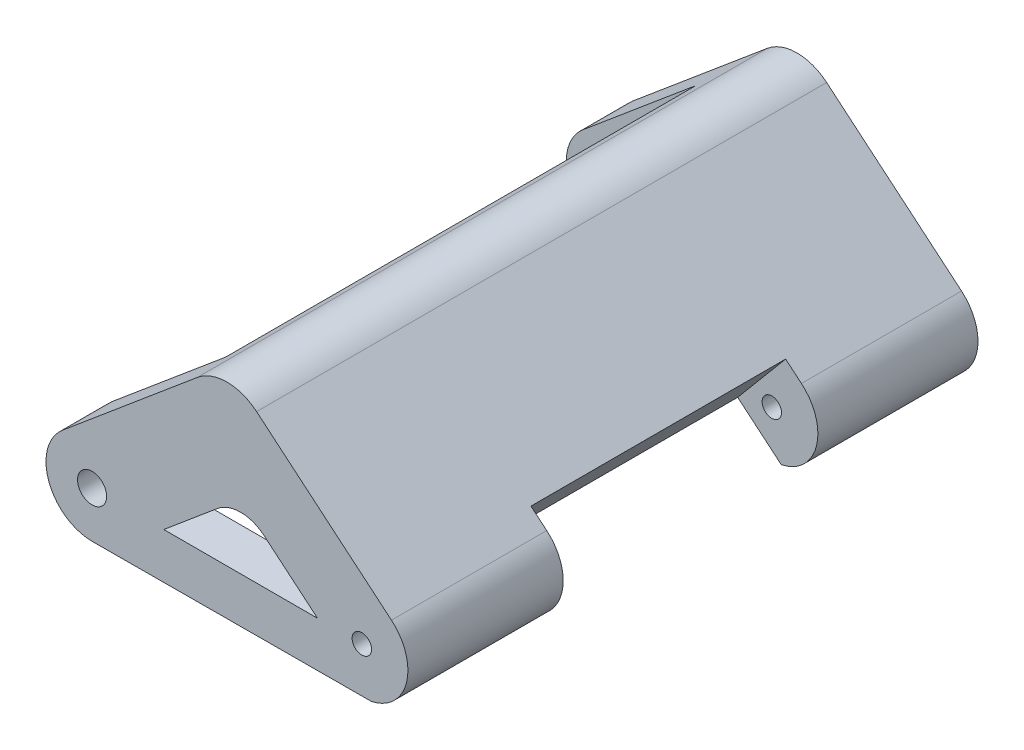
from build123d import *

# Parameters (mm, degrees)
SKETCH_1_R          = 1.2
SKETCH_1_R_2        = 0.8
EXTRUDE_3_DEPTH     = 47
SKETCH_6_W          = 5.5
SKETCH_6_H          = 21
CUT_EXTRUDE_4_DEPTH = 53.526968295
SKETCH_7_W          = 15
SKETCH_7_H          = 38.8
CUT_EXTRUDE_5_DEPTH = 56.899041136
CUT_EXTRUDE_6_DEPTH = 56.31273986
CUT_EXTRUDE_7_DEPTH = 56.31273986
SKETCH_10_W         = 38.8
SKETCH_10_H         = 7.6
CUT_EXTRUDE_8_DEPTH = 1
EXTRUDE_4_DEPTH     = 3.5
FILLET_1_R          = 3
SKETCH_12_R         = 3.5
CUT_EXTRUDE_9_DEPTH = 2


with BuildPart() as part:
    # 草图1 → 凸台-拉伸3 (new body)
    with BuildSketch(Plane.XY):
        with BuildLine():
            Line((8.677407083, 12.241756783), (-2.442592917, 2.910968884))
            ThreePointArc((-2.442592917, 2.910968884), (-2.910968884, -2.442592917), (2.442592917, -2.910968884))
            Line((2.442592917, -2.910968884), (11.12, 4.370240199))
            Line((11.12, 4.370240199), (19.797407083, -2.910968884))
            ThreePointArc((19.797407083, -2.910968884), (25.150968884, -2.442592917), (24.682592917, 2.910968884))
            Line((24.682592917, 2.910968884), (13.562592917, 12.241756783))
            ThreePointArc((13.562592917, 12.241756783), (11.12, 13.130787899), (8.677407083, 12.241756783))
        make_face()
        Circle(SKETCH_1_R, mode=Mode.SUBTRACT)
        with Locations((22.24, 0)):
            Circle(SKETCH_1_R_2, mode=Mode.SUBTRACT)
    extrude(amount=EXTRUDE_3_DEPTH)

    # 草图6 → 切除-拉伸4 (cut, through all)
    with BuildSketch(Plane(origin=(11.631625181, 13.862031097, 0), x_dir=(0.7660444431189771, -0.6427876096865404, 0), z_dir=(0.6427876096865404, 0.7660444431189771, 0))):
        with Locations((18.086828415, -23.7)):
            Rectangle(SKETCH_6_W, SKETCH_6_H)
    extrude(amount=-CUT_EXTRUDE_4_DEPTH, mode=Mode.SUBTRACT)

    # 草图7 → 切除-拉伸5 (cut, through all)
    with BuildSketch(Plane(origin=(-2.442592917, 2.910968884, 0), x_dir=(0.766044443118977, 0.6427876096865407, 0), z_dir=(-0.6427876096865407, 0.766044443118977, 0))):
        with Locations((3.7, -23.5)):
            Rectangle(SKETCH_7_W, SKETCH_7_H)
    extrude(amount=-CUT_EXTRUDE_5_DEPTH, mode=Mode.SUBTRACT)

    # 草图8 → 切除-拉伸6 (cut, through all)
    with BuildSketch(Plane.XY.offset(47)):
        with BuildLine():
            Line((19.03136264, -2.268181274), (23.018534178, -3.719393033))
            ThreePointArc((23.018534178, -3.719393033), (21.314980934, -3.685693928), (19.797407083, -2.910968884))
            Line((19.797407083, -2.910968884), (19.03136264, -2.268181274))
        make_face()
    extrude(amount=-CUT_EXTRUDE_6_DEPTH, mode=Mode.SUBTRACT)

    # 草图9 → 切除-拉伸7 (cut, through all)
    with BuildSketch(Plane.XY.offset(47)):
        Polygon((23.018534178, -3.719393033), (12.248842355, 5.317451403), (11.12, 4.370240199), (19.03136264, -2.268181274), align=None)
    extrude(amount=-CUT_EXTRUDE_7_DEPTH, mode=Mode.SUBTRACT)

    # 草图10 → 切除-拉伸8 (cut)
    with BuildSketch(Plane(origin=(8.579697763, 7.199221228, 0), x_dir=(0, 0, 1), z_dir=(-0.7660444431189769, -0.6427876096865407, 0))):
        with Locations((23.5, 0)):
            Rectangle(SKETCH_10_W, SKETCH_10_H)
    extrude(amount=-CUT_EXTRUDE_8_DEPTH, mode=Mode.SUBTRACT)

    # 草图11 → 凸台-拉伸4 (add)
    with BuildSketch(Plane.XY.offset(47)):
        Polygon((0.013310717, -3.799976687), (23.018534178, -3.719393033), (18.585934169, 0), (5.911750542, 0), align=None)
    extrude_4 = extrude(amount=-EXTRUDE_4_DEPTH)

    # 镜向2: 凸台-拉伸4 across plane
    add(extrude_4.mirror(Plane(origin=(0, 0, 23.5), x_dir=(1, 0, 0), z_dir=(0, 0, -1))))

    # 圆角1
    # the kernel refuses this fillet: 3 mm, written as the material it adds along each edge
    with BuildSketch(Plane(origin=(12.248842355, 5.317451403, 47), x_dir=(0.7660444431189768, -0.6427876096865407, 0), z_dir=(0, 0, -1))) as fillet_1_piece_1_section:
        with BuildLine():
            CenterArc((FILLET_1_R * 0.839099631177, FILLET_1_R), FILLET_1_R, 190, 80)
            Line((-FILLET_1_R * 0.145708121835, FILLET_1_R * 0.826351822333), (0, 0))
            Line((0, 0), (FILLET_1_R * 0.839099631177, 0))
        make_face()
    fillet_1_piece_1 = extrude(amount=47, mode=Mode.PRIVATE)
    fillet_1_piece_1 = split(fillet_1_piece_1, bisect_by=Plane(origin=(12.660529152, 4.67576924, 42.9), z_dir=(0, 0, 1)), keep=Keep.TOP, mode=Mode.PRIVATE)
    fillet_1_piece_1 = split(fillet_1_piece_1, bisect_by=Plane(origin=(12.274400975, 4.351769229, 44.95), z_dir=(0.7660444431189769, 0.6427876096865407, 0)), keep=Keep.TOP, mode=Mode.PRIVATE)
    add(fillet_1_piece_1)
    with BuildSketch(Plane(origin=(12.248842355, 5.317451403, 47), x_dir=(0.7660444431189768, -0.6427876096865407, 0), z_dir=(0, 0, -1))) as fillet_1_piece_2_section:
        with BuildLine():
            CenterArc((FILLET_1_R * 0.839099631177, FILLET_1_R), FILLET_1_R, 190, 80)
            Line((-FILLET_1_R * 0.145708121835, FILLET_1_R * 0.826351822333), (0, 0))
            Line((0, 0), (FILLET_1_R * 0.839099631177, 0))
        make_face()
    fillet_1_piece_2 = extrude(amount=47, mode=Mode.PRIVATE)
    fillet_1_piece_2 = split(fillet_1_piece_2, bisect_by=Plane(origin=(11.44751572, 4.445896391, 42.9), z_dir=(0, 0, 1)), keep=Keep.TOP, mode=Mode.PRIVATE)
    fillet_1_piece_2 = split(fillet_1_piece_2, bisect_by=Plane(origin=(11.886403327, 4.81416682, 44.95), z_dir=(-0.7660444431189769, -0.6427876096865407, 0)), keep=Keep.TOP, mode=Mode.PRIVATE)
    add(fillet_1_piece_2)
    with BuildSketch(Plane(origin=(12.248842355, 5.317451403, 47), x_dir=(0.7660444431189768, -0.6427876096865407, 0), z_dir=(0, 0, -1))) as fillet_1_piece_3_section:
        with BuildLine():
            CenterArc((FILLET_1_R * 0.839099631177, FILLET_1_R), FILLET_1_R, 190, 80)
            Line((-FILLET_1_R * 0.145708121835, FILLET_1_R * 0.826351822333), (0, 0))
            Line((0, 0), (FILLET_1_R * 0.839099631177, 0))
        make_face()
    fillet_1_piece_3 = extrude(amount=47, mode=Mode.PRIVATE)
    fillet_1_piece_3 = split(fillet_1_piece_3, bisect_by=Plane(origin=(12.660529152, 4.67576924, 42.9), z_dir=(0, 0, -1)), keep=Keep.TOP, mode=Mode.PRIVATE)
    fillet_1_piece_3 = split(fillet_1_piece_3, bisect_by=Plane(origin=(12.274400975, 4.351769229, 23.5), z_dir=(0.7660444431189769, 0.6427876096865407, 0)), keep=Keep.TOP, mode=Mode.PRIVATE)
    fillet_1_piece_3 = split(fillet_1_piece_3, bisect_by=Plane(origin=(12.660529152, 4.67576924, 4.1), z_dir=(0, 0, 1)), keep=Keep.TOP, mode=Mode.PRIVATE)
    add(fillet_1_piece_3)
    with BuildSketch(Plane(origin=(12.248842355, 5.317451403, 47), x_dir=(0.7660444431189768, -0.6427876096865407, 0), z_dir=(0, 0, -1))) as fillet_1_piece_4_section:
        with BuildLine():
            CenterArc((FILLET_1_R * 0.839099631177, FILLET_1_R), FILLET_1_R, 190, 80)
            Line((-FILLET_1_R * 0.145708121835, FILLET_1_R * 0.826351822333), (0, 0))
            Line((0, 0), (FILLET_1_R * 0.839099631177, 0))
        make_face()
    fillet_1_piece_4 = extrude(amount=47, mode=Mode.PRIVATE)
    fillet_1_piece_4 = split(fillet_1_piece_4, bisect_by=Plane(origin=(12.274400975, 4.351769229, 2.05), z_dir=(0.7660444431189769, 0.6427876096865407, 0)), keep=Keep.TOP, mode=Mode.PRIVATE)
    fillet_1_piece_4 = split(fillet_1_piece_4, bisect_by=Plane(origin=(12.660529152, 4.67576924, 4.1), z_dir=(0, 0, -1)), keep=Keep.TOP, mode=Mode.PRIVATE)
    add(fillet_1_piece_4)
    with BuildSketch(Plane(origin=(12.248842355, 5.317451403, 47), x_dir=(0.7660444431189768, -0.6427876096865407, 0), z_dir=(0, 0, -1))) as fillet_1_piece_5_section:
        with BuildLine():
            CenterArc((FILLET_1_R * 0.839099631177, FILLET_1_R), FILLET_1_R, 190, 80)
            Line((-FILLET_1_R * 0.145708121835, FILLET_1_R * 0.826351822333), (0, 0))
            Line((0, 0), (FILLET_1_R * 0.839099631177, 0))
        make_face()
    fillet_1_piece_5 = extrude(amount=47, mode=Mode.PRIVATE)
    fillet_1_piece_5 = split(fillet_1_piece_5, bisect_by=Plane(origin=(11.886403327, 4.81416682, 2.05), z_dir=(-0.7660444431189769, -0.6427876096865407, 0)), keep=Keep.TOP, mode=Mode.PRIVATE)
    fillet_1_piece_5 = split(fillet_1_piece_5, bisect_by=Plane(origin=(11.44751572, 4.445896391, 4.1), z_dir=(0, 0, -1)), keep=Keep.TOP, mode=Mode.PRIVATE)
    add(fillet_1_piece_5)

    # 草图12 → 切除-拉伸9 (cut)
    with BuildSketch(Plane.XY.offset(4.1)):
        with Locations((5.5, -3.780757684)):
            Circle(SKETCH_12_R)
    extrude(amount=-CUT_EXTRUDE_9_DEPTH, mode=Mode.SUBTRACT)


solid = part.part
